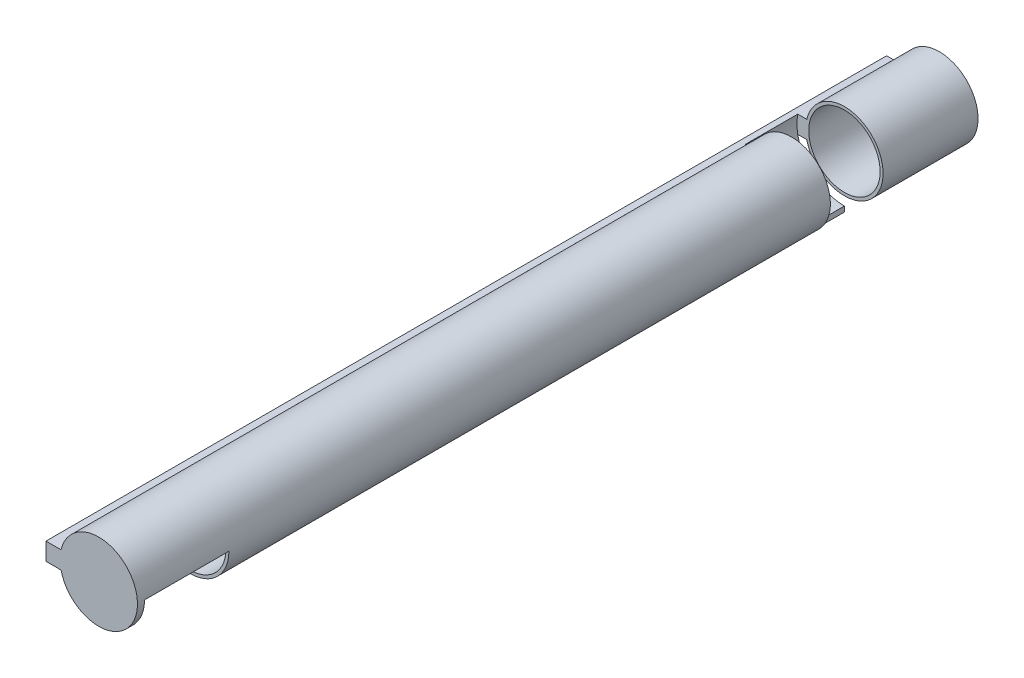
from build123d import *
from build123d.topology import SkipClean

# Parameters (mm, degrees)
SCHIZZO1_R                  = 11
SCHIZZO1_R_2                = 10.15
TUBO_DEPTH                  = 210
INGRESSOCAVI_DEPTH          = 27
SCHIZZO4_R                  = 11
SCHIZZO4_R_2                = 6.5
FONDOCORSA_DEPTH            = 3
SCHIZZO5_R                  = 11
TAPPO_DEPTH                 = 2
BASEINFERIORE_DEPTH         = 239
SCHIZZO7_R                  = 13.5
TAGLIOANELLO_DEPTH          = 15
SUPPORTOANELLO_DEPTH        = 15
FACILITAZIONECAVI_DEPTH     = 3
RACCORDOFACILITAZIONECAVI_R = 8


with BuildPart() as part:
    # Schizzo1 → Tubo (new body)
    with BuildSketch(Plane.XY):
        Circle(SCHIZZO1_R)
        Circle(SCHIZZO1_R_2, mode=Mode.SUBTRACT)
    extrude(amount=TUBO_DEPTH)

    # Schizzo2 → IngressoCavi (add)
    with BuildSketch(Plane.XY.offset(210)):
        with BuildLine():
            Line((0, -10.15), (0, -11))
            ThreePointArc((0, -11), (-7.778174593, 7.778174593), (11, 0))
            Line((11, 0), (10.15, 0))
            ThreePointArc((10.15, 0), (-7.177133829, 7.177133829), (0, -10.15))
        make_face()
    extrude(amount=INGRESSOCAVI_DEPTH)

    # Schizzo4 → FondoCorsa (add)
    with SkipClean():  # the faces are left unmerged after this step: merging them gives an invalid solid
        with BuildSketch(Plane.XY.offset(210)):
            Circle(SCHIZZO4_R)
            Circle(SCHIZZO4_R_2, mode=Mode.SUBTRACT)
        extrude(amount=FONDOCORSA_DEPTH)

    # Schizzo5 → Tappo (add)
    with SkipClean():  # the faces are left unmerged after this step: merging them gives an invalid solid
        with BuildSketch(Plane.XY.offset(237)):
            Circle(SCHIZZO5_R)
        extrude(amount=TAPPO_DEPTH)
    add(part.part.scale(1), mode=Mode.REPLACE)  # the faces are merged on a copy

    # Schizzo6 → BaseInferiore (add)
    with SkipClean():  # the faces are left unmerged after this step: merging them gives an invalid solid
        with BuildSketch(Plane.XY):
            Polygon((-11, 2.5), (-15, 2.5), (-15, -2.5), (-11, -2.5), (-10.712142643, -2.5), (-10.712142643, 2.5), align=None)
        extrude(amount=BASEINFERIORE_DEPTH)

    # Schizzo7 → TaglioAnello (cut)
    with BuildSketch(Plane.XY.offset(27)):
        Circle(SCHIZZO7_R)
    extrude(amount=TAGLIOANELLO_DEPTH, mode=Mode.SUBTRACT)

    # Schizzo8 → SupportoAnello (add)
    with SkipClean():  # the faces are left unmerged after this step: merging them gives an invalid solid
        with BuildSketch(Plane.XY.offset(27)):
            with BuildLine():
                Line((-15, 0), (-13.5, 0))
                ThreePointArc((-13.5, 0), (-9.545941546, -9.545941546), (0, -13.5))
                Line((0, -13.5), (0, -15))
                ThreePointArc((0, -15), (-10.606601718, -10.606601718), (-15, 0))
            make_face()
        extrude(amount=SUPPORTOANELLO_DEPTH)

    # Schizzo9 → FacilitazioneCavi (cut)
    with SkipClean():  # the faces are left unmerged after this step: merging them gives an invalid solid
        with BuildSketch(Plane(origin=(0, 0, 210), x_dir=(-1, 0, 0), z_dir=(0, 0, -1))):
            with BuildLine():
                Line((-10.15, 0), (0, 0))
                Line((0, 0), (0, -10.15))
                ThreePointArc((0, -10.15), (-7.177133829, -7.177133829), (-10.15, 0))
            make_face()
        extrude(amount=-FACILITAZIONECAVI_DEPTH, mode=Mode.SUBTRACT)

    # RaccordoFacilitazioneCavi
    # the kernel refuses this fillet: 8 mm, written as the material it takes off along each edge
    with BuildSketch(Plane(origin=(0, -6.5, 222.125), x_dir=(0, -1, 0), z_dir=(0, 0, -1)), Plane(origin=(6.5, 0, 200.875), x_dir=(1, 0, 0), z_dir=(0, 0, 1))) as raccordofacilitazionecavi_piece_1:
        with BuildLine():
            CenterArc((5.779433498, 7.711388525), RACCORDOFACILITAZIONECAVI_R, 212.128500683, 42.43446725)
            Line((-0.995426363, 3.456829339), (-1.13092356, 3.371738155))
            ThreePointArc((-1.13092356, 3.371738155), (-0.407564337, 1.754373873), (-0.16, 0))
            Line((-0.16, 0), (0, -0.16))
            ThreePointArc((0, -0.16), (1.825, -0.16), (3.60741133, -0.15422777))
            Line((3.60741133, -0.15422777), (3.65, 0))
        make_face()
    extrude(amount=21.25, mode=Mode.SUBTRACT)


solid = part.part
